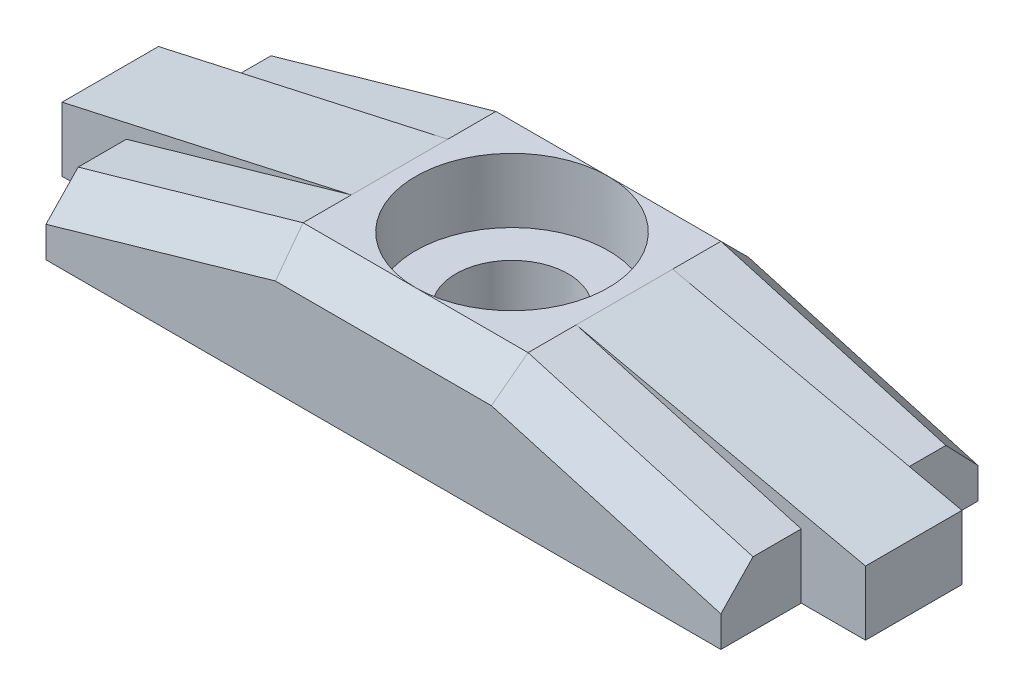
from build123d import *

# Parameters (mm, degrees)
SKETCH1_W                       = 21
SKETCH1_H                       = 2.5
SKETCH1_H_2                     = 3
SKETCH1_W_2                     = 2
BOSS_EXTRUDE1_DEPTH             = 2
BOSS_EXTRUDE2_REACH             = 15.276
BOSS_EXTRUDE2_DIRECTION_2_REACH = 15.276
BOSS_EXTRUDE3_REACH             = 17.37
SKETCH5_R                       = 1.75
CUT_EXTRUDE1_DEPTH              = 14.720422734
SKETCH6_R                       = 3
CUT_EXTRUDE2_DEPTH              = 2
CHAMFER1_SIZE                   = 1


with BuildPart() as part:
    # Sketch1 → Boss-Extrude1 (new body)
    with BuildSketch(Plane(origin=(0, 0, 0), x_dir=(1, 0, 0), z_dir=(0, 1, 0))):
        with Locations((0, -2.75)):
            Rectangle(SKETCH1_W, SKETCH1_H)
        Rectangle(SKETCH1_W, SKETCH1_H_2)
        with Locations((-11.5, 0)):
            Rectangle(SKETCH1_W_2, SKETCH1_H_2)
        with Locations((11.5, 0)):
            Rectangle(SKETCH1_W_2, SKETCH1_H_2)
        with Locations((0, 2.75)):
            Rectangle(SKETCH1_W, SKETCH1_H)
    extrude(amount=BOSS_EXTRUDE1_DEPTH)

    # Boss-Extrude2: up to this face of the body (flat: up to its plane)
    boss_extrude2_end = Plane(part.part.faces().sort_by_distance((-11.5, 1, 1.5))[0])
    # Sketch3 → Boss-Extrude2 (add, up to the picked face)
    with BuildSketch(Plane.XY, mode=Mode.PRIVATE) as boss_extrude2_sk1:
        Polygon((-12.5, 2), (-3.5, 4), (3.5, 4), (12.5, 2), align=None)
    boss_extrude2_tool1 = split(extrude(boss_extrude2_sk1.sketch, amount=BOSS_EXTRUDE2_REACH, mode=Mode.PRIVATE), bisect_by=boss_extrude2_end, keep=Keep.BOTH, mode=Mode.PRIVATE)
    add(boss_extrude2_tool1.solids().sort_by(Axis((0, 2.8125, 0), (0, 0, 1)))[0])

    # Boss-Extrude2 direction 2: up to this face of the body (flat: up to its plane)
    boss_extrude2_direction_2_end = Plane(part.part.faces().sort_by_distance((-11.5, 1, -1.5))[0])
    # Sketch3 → Boss-Extrude2 direction 2 (add, up to the picked face)
    with BuildSketch(Plane.XY, mode=Mode.PRIVATE) as boss_extrude2_direction_2_sk1:
        Polygon((-12.5, 2), (-3.5, 4), (3.5, 4), (12.5, 2), align=None)
    boss_extrude2_direction_2_tool1 = split(extrude(boss_extrude2_direction_2_sk1.sketch, amount=-BOSS_EXTRUDE2_DIRECTION_2_REACH, mode=Mode.PRIVATE), bisect_by=boss_extrude2_direction_2_end, keep=Keep.BOTH, mode=Mode.PRIVATE)
    add(boss_extrude2_direction_2_tool1.solids().sort_by(Axis((0, 2.8125, 0), (0, 0, -1)))[0])

    # Boss-Extrude3: up to this face of the body (flat: up to its plane)
    boss_extrude3_end = Plane(part.part.faces().sort_by_distance((0, 1, -4))[0])
    # Sketch4 → Boss-Extrude3 (add, up to the picked face)
    with BuildSketch(Plane.XY.offset(4), mode=Mode.PRIVATE) as boss_extrude3_sk1:
        Polygon((10.5, 2), (3.5, 4), (-3.5, 4), (-10.5, 2), align=None)
    boss_extrude3_tool1 = split(extrude(boss_extrude3_sk1.sketch, amount=-BOSS_EXTRUDE3_REACH, mode=Mode.PRIVATE), bisect_by=boss_extrude3_end, keep=Keep.BOTH, mode=Mode.PRIVATE)
    add(boss_extrude3_tool1.solids().sort_by(Axis((0, 2.833333, 4), (0, 0, -1)))[0])

    # Sketch5 → Cut-Extrude1 (cut, through all)
    with BuildSketch(Plane(origin=(0, 4, 0), x_dir=(1, 0, 0), z_dir=(0, 1, 0))):
        with Locations(Location((0, 0, 0), (0, 0, 270))):
            Circle(SKETCH5_R)
    extrude(amount=-CUT_EXTRUDE1_DEPTH, mode=Mode.SUBTRACT)

    # Sketch6 → Cut-Extrude2 (cut)
    with BuildSketch(Plane(origin=(0, 4, 0), x_dir=(1, 0, 0), z_dir=(0, 1, 0))):
        with Locations(Location((0, 0, 0), (0, 0, 270))):
            Circle(SKETCH6_R)
    extrude(amount=-CUT_EXTRUDE2_DEPTH, mode=Mode.SUBTRACT)

    # Chamfer1
    chamfer1_edges = [part.edges().sort_by_distance(p)[0] for p in [
        (7, 3, 4),
        (0, 4, 4),
        (-7, 3, 4),
        (7, 3, -4),
        (0, 4, -4),
        (-7, 3, -4),
    ]]
    chamfer(chamfer1_edges, length=CHAMFER1_SIZE - 0.0001)  # a hair under: the kernel refuses the full size


solid = part.part
